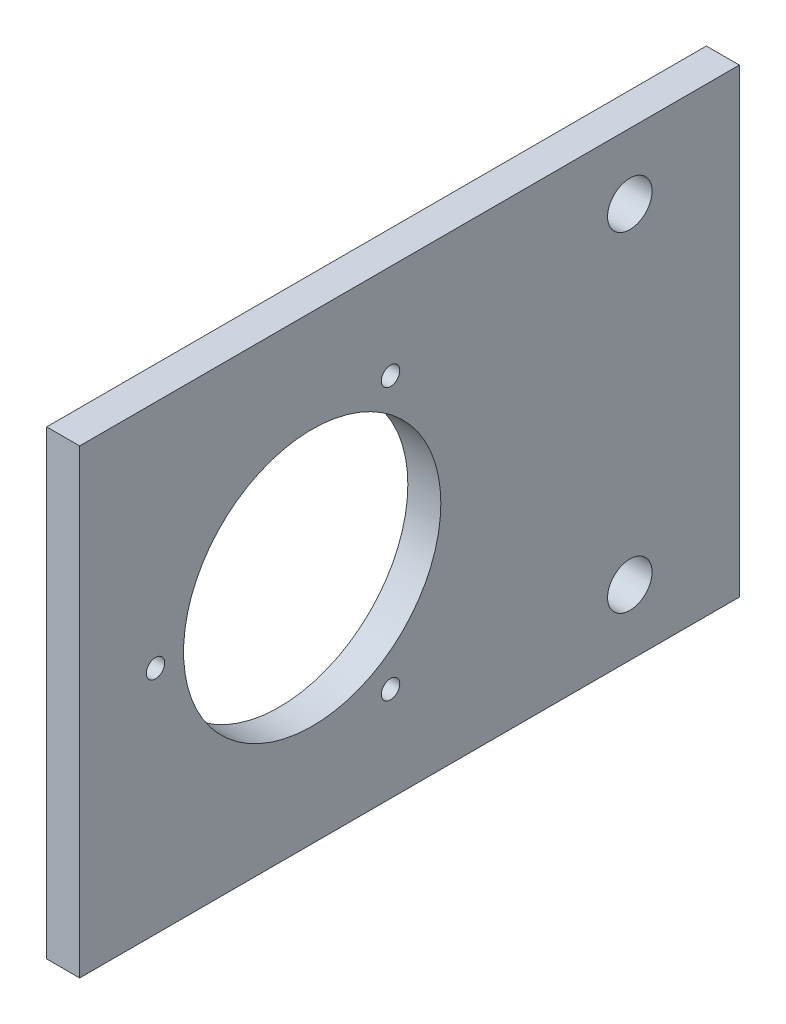
from build123d import *

# Parameters (mm, degrees)
SKETCH1_W           = 69.85
SKETCH1_H           = 100
SKETCH1_R           = 19.5
SKETCH1_R_2         = 3.37312
SKETCH1_R_3         = 1.4
BOSS_EXTRUDE1_DEPTH = 5


with BuildPart() as part:
    # Sketch1 → Boss-Extrude1 (new body)
    with BuildSketch(Plane.YZ):
        Rectangle(SKETCH1_W, SKETCH1_H)
        with Locations((0, 14.75)):
            Circle(SKETCH1_R, mode=Mode.SUBTRACT)
        with Locations((-25, -33.4)):
            Circle(SKETCH1_R_2, mode=Mode.SUBTRACT)
        with Locations((25, -33.4)):
            Circle(SKETCH1_R_2, mode=Mode.SUBTRACT)
        with Locations((-20.56810334, 2.875)):
            Circle(SKETCH1_R_3, mode=Mode.SUBTRACT)
        with Locations((20.56810334, 2.875)):
            Circle(SKETCH1_R_3, mode=Mode.SUBTRACT)
        with Locations((0, 38.5)):
            Circle(SKETCH1_R_3, mode=Mode.SUBTRACT)
    extrude(amount=BOSS_EXTRUDE1_DEPTH)


solid = part.part
